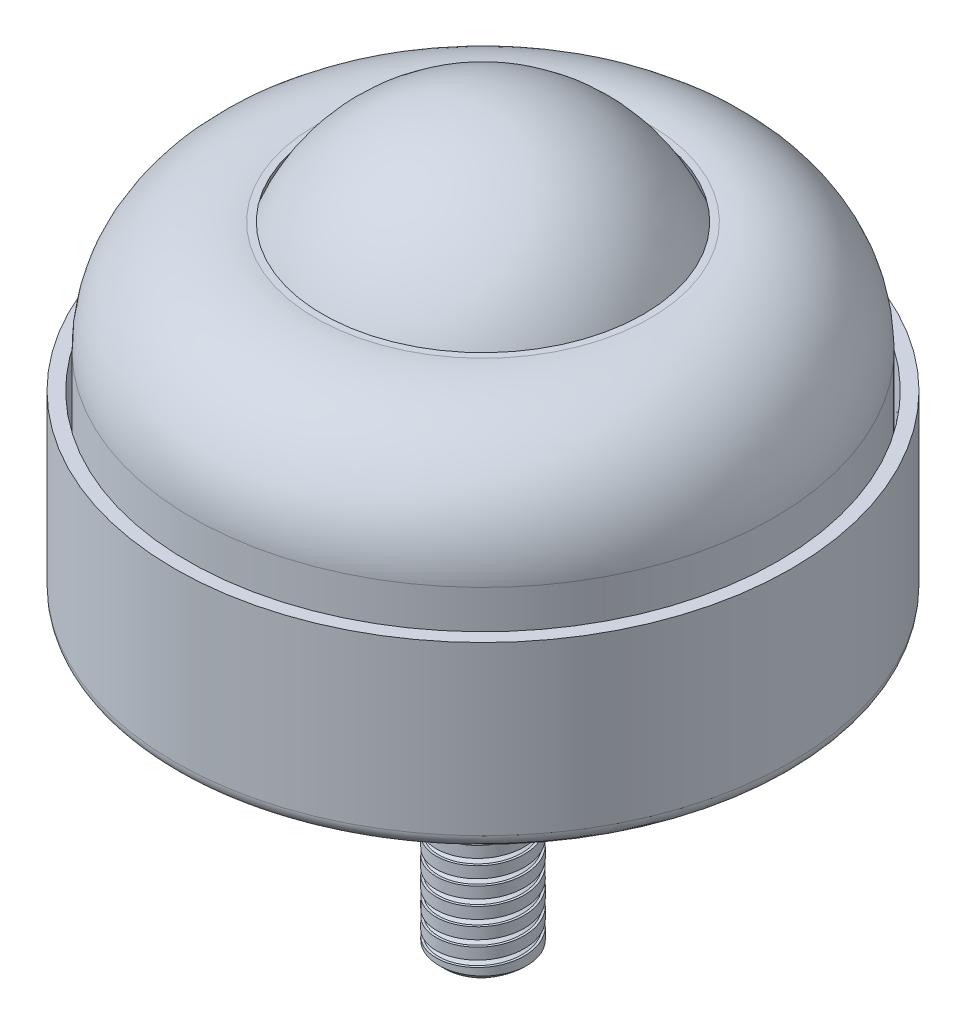
from build123d import *

# Parameters (mm, degrees)
SKETCH4_W           = 7.14375
SKETCH4_H           = 7.14375
CUT_EXTRUDE1_DEPTH  = 0.9525
SKETCH5_W           = 6.57225
SKETCH5_H           = 6.57225
CUT_EXTRUDE2_DEPTH  = 0.9525
FILLET1_R           = 1.524
FILLET2_R           = 0.1905
SKETCH7_W           = 6.35
SKETCH7_H           = 3.4925
BOSS_EXTRUDE1_DEPTH = 3.175
SKETCH8_OUTSIDE_W   = 79.734
SKETCH8_OUTSIDE_H   = 79.734
SKETCH8_OUTSIDE_R   = 4.041115254
CUT_EXTRUDE3_DEPTH  = 47.96712951
CUT_EXTRUDE3_DRAFT  = -10
FILLET3_R           = 0.127
CUT_SWEEP1_PITCH    = 1.27
CUT_SWEEP1_TO       = 17.5


with BuildPart() as part:
    # Sketch3 → Revolve1 (revolve)
    with BuildSketch(Plane.XY, mode=Mode.PRIVATE) as revolve1_sk:
        with BuildLine():
            ThreePointArc((20.955, 19.7485), (18.288003578, 25.737218359), (12.052584365, 27.761363795))
            Line((12.052584365, 27.761363795), (0, 27.761363795))
            Line((0, 27.761363795), (0, 1.5875))
            Line((0, 1.5875), (3.175, 1.5875))
            Line((3.175, 1.5875), (17.85, 1.5875))
            Line((17.85, 1.5875), (20.39, 4.1275))
            Line((20.39, 4.1275), (21.209, 4.1275))
            ThreePointArc((21.209, 4.1275), (21.92742049, 4.42507951), (22.225, 5.1435))
            Line((22.225, 5.1435), (22.225, 17.2085))
            Line((22.225, 17.2085), (21.2725, 17.2085))
            Line((21.2725, 17.2085), (20.955, 11.176))
            Line((20.955, 11.176), (20.955, 17.2085))
            Line((20.955, 17.2085), (20.955, 19.7485))
        make_face()
    revolve(revolve1_sk.sketch.rotate(Axis((0, 34.9, 0), (0, -1, 0)), 180), axis=Axis((0, 34.9, 0), (0, -1, 0)))

    # Sketch4 → Cut-Extrude1 (cut)
    with BuildSketch(Plane.XZ.offset(-1.5875)):
        Rectangle(SKETCH4_W, SKETCH4_H)
    extrude(amount=-CUT_EXTRUDE1_DEPTH, mode=Mode.SUBTRACT)

    # Sketch5 → Cut-Extrude2 (cut)
    with BuildSketch(Plane.XZ.offset(-2.54)):
        Rectangle(SKETCH5_W, SKETCH5_H)
    extrude(amount=-CUT_EXTRUDE2_DEPTH, mode=Mode.SUBTRACT)

    # Fillet1
    fillet1_edges = [part.edges().sort_by_distance(p)[0] for p in [
        (20.39, 4.1275, 0),
        (17.85, 1.5875, 0),
    ]]
    fillet(fillet1_edges, radius=FILLET1_R)

    # Fillet2
    fillet2_edges = [part.edges().sort_by_distance(p)[0] for p in [
        (-3.571875, 2.54, 0),
        (-3.571875, 2.06375, -3.571875),
        (0, 2.54, 3.571875),
        (-3.571875, 2.06375, 3.571875),
        (3.571875, 2.54, 0),
        (3.571875, 2.06375, 3.571875),
        (0, 2.54, -3.571875),
        (3.571875, 2.06375, -3.571875),
        (-3.571875, 1.5875, 0),
        (0, 1.5875, -3.571875),
        (3.571875, 1.5875, 0),
        (0, 1.5875, 3.571875),
        (-3.286125, 3.01625, -3.286125),
        (-3.286125, 3.01625, 3.286125),
        (3.286125, 3.01625, 3.286125),
        (3.286125, 3.01625, -3.286125),
    ]]
    fillet(fillet2_edges, radius=FILLET2_R)

    # Indent1: read off the stored shape, not the designer's step
    # Indent1 outline → Indent1 (revolve, cut)
    with BuildSketch(Plane.XY):
        with BuildLine():
            Line((0, 27.761363807), (0, 9.373))
            ThreePointArc((0, 9.373), (10.859731639, 15.373715672), (11.558683386, 27.761363807))
            Line((11.558683386, 27.761363807), (0, 27.761363807))
        make_face()
    revolve(axis=Axis((0, 0, 0), (0, 1, 0)), mode=Mode.SUBTRACT)


with BuildPart() as body_2:
    # Sketch6 → Revolve2 (revolve)
    with BuildSketch(Plane.XY):
        with BuildLine():
            Line((0, 34.9), (0, 9.5))
            ThreePointArc((0, 9.5), (12.7, 22.2), (0, 34.9))
        make_face()
    revolve(axis=Axis((0, 27.761363795, 0), (0, -1, 0)))


with BuildPart() as body_3:
    # Revolve3: read off the stored shape, not the designer's step
    # Revolve3 outline → Revolve3 (revolve)
    with BuildSketch(Plane.XY):
        Polygon((3.175, 1.5875), (0, 1.5875), (0, -17.5), (2.7559, -17.5), (3.175, -17.0809), align=None)
    revolve(axis=Axis((0, 0, 0), (0, 1, 0)))


with BuildPart() as body_4:
    # Sketch7 → Boss-Extrude1 (new, symmetric)
    with BuildSketch(Plane.XY):
        with Locations((0, 1.74625)):
            Rectangle(SKETCH7_W, SKETCH7_H)
    extrude(amount=BOSS_EXTRUDE1_DEPTH, both=True)


with BuildPart() as cut_extrude3_tool:
    # Sketch8 outside → Cut-Extrude3 (with draft: the straight prism first)
    with BuildSketch(Plane.XZ):
        Rectangle(SKETCH8_OUTSIDE_W, SKETCH8_OUTSIDE_H)
        Circle(SKETCH8_OUTSIDE_R, mode=Mode.SUBTRACT)
    extrude(amount=-CUT_EXTRUDE3_DEPTH)
    # Cut-Extrude3: the draft: its side faces are tilted about the plane it starts from
    cut_extrude3_sides = [cut_extrude3_tool.faces().sort_by_distance(p)[0] for p in [
        (0, 23.983564755, -39.867),
        (39.867, 23.983564755, 0),
        (0, 23.983564755, 39.867),
        (-39.867, 23.983564755, 0),
        (-4.041115254, 23.983564755, 0),
    ]]
    draft(cut_extrude3_sides, Plane.XZ, CUT_EXTRUDE3_DRAFT)


with BuildPart() as body_4_1:
    add(body_4.part)

    # Cut-Extrude3: cut by cut_extrude3_tool
    add(cut_extrude3_tool.part, mode=Mode.SUBTRACT)

    # Fillet3
    fillet3_edges = [body_4_1.edges().sort_by_distance(p)[0] for p in [
        (0, 0, 3.175),
        (3.175, 0, 0),
        (0, 0, -3.175),
        (-3.175, 0, 0),
        (-2.8575, 0, 2.8575),
        (2.8575, 0, 2.8575),
        (2.8575, 0, -2.8575),
        (-2.8575, 0, -2.8575),
    ]]
    fillet(fillet3_edges, radius=FILLET3_R)


with BuildPart() as body_3_1:
    add(body_3.part)

    # Combine1: union part, body 4
    add(part.part)
    add(body_4_1.part)


with BuildPart() as body_3_2:
    # Split1: the piece on the far side of the plane
    add(body_3_1.part)
    split(bisect_by=Plane.ZX, keep=Keep.BOTTOM)

    # Cut-Sweep1: arcs per turn and ends read off the stored shape
    # Cut-Sweep1: the profile of Sketch10 screwed along a right-hand helix through 14.779528 turns, 8 arcs to a turn; built about Z, then put on its axis
    cut_sweep1_z = Axis((0, 0, 0), (0, 0, 1))
    cut_sweep1_corners = [(3.009370383, 0, -0.784683588), (2.61262927, 0, -0.555625), (3.009370383, 0, -0.326566412), (3.209370383, 0, -0.326566412), (3.209370383, 0, -0.784683588)]
    with BuildLine(mode=Mode.PRIVATE) as cut_sweep1_profile:
        Line(cut_sweep1_corners[0], cut_sweep1_corners[1])
        Line(cut_sweep1_corners[1], cut_sweep1_corners[2])
        Line(cut_sweep1_corners[2], cut_sweep1_corners[3])
        Line(cut_sweep1_corners[3], cut_sweep1_corners[4])
        Line(cut_sweep1_corners[4], cut_sweep1_corners[0])
    cut_sweep1_cap = Face(cut_sweep1_profile.wire())
    cut_sweep1_turn_angles = [0, 22.5, 45, 67.5, 90, 112.5, 135, 157.5, 180, 202.5, 225, 247.5, 270, 292.5, 315, 337.5, 360]
    cut_sweep1_turn_weights = [1, 0.9238795325112867, 1, 0.9238795325112867, 1, 0.9238795325112867, 1, 0.9238795325112867, 1, 0.9238795325112867, 1, 0.9238795325112867, 1, 0.9238795325112867, 1, 0.9238795325112867, 1]
    cut_sweep1_turn_rails = [Edge.make_bspline([Vector(p[0], p[1], 0).rotate(cut_sweep1_z, cut_sweep1_turn_angles[k]) / cut_sweep1_turn_weights[k] + Vector(0, 0, p[2] + CUT_SWEEP1_PITCH * cut_sweep1_turn_angles[k] / 360) for k in range(17)], [0, 0, 0, 1, 1, 2, 2, 3, 3, 4, 4, 5, 5, 6, 6, 7, 7, 8, 8, 8], 2, cut_sweep1_turn_weights) for p in cut_sweep1_corners]
    cut_sweep1_turn_sides = [Face.make_surface_from_curves(cut_sweep1_turn_rails[p[0]], cut_sweep1_turn_rails[p[1]]) for p in [(0, 1), (1, 2), (2, 3), (3, 4), (4, 0)]]
    cut_sweep1_last_angles = [5040, 5062.5, 5085, 5107.5, 5130, 5152.5, 5175, 5197.5, 5220, 5242.5, 5265, 5287.5, 5310, 5315.31496063, 5320.62992126]
    cut_sweep1_last_weights = [1, 0.9238795325112867, 1, 0.9238795325112867, 1, 0.9238795325112867, 1, 0.9238795325112867, 1, 0.9238795325112867, 1, 0.9238795325112867, 1, 0.9957005451488364, 1]
    cut_sweep1_last_rails = [Edge.make_bspline([Vector(p[0], p[1], 0).rotate(cut_sweep1_z, cut_sweep1_last_angles[k]) / cut_sweep1_last_weights[k] + Vector(0, 0, p[2] + CUT_SWEEP1_PITCH * cut_sweep1_last_angles[k] / 360) for k in range(15)], [0, 0, 0, 1, 1, 2, 2, 3, 3, 4, 4, 5, 5, 6, 6, 7, 7, 7], 2, cut_sweep1_last_weights) for p in cut_sweep1_corners]
    cut_sweep1_last_sides = [Face.make_surface_from_curves(cut_sweep1_last_rails[p[0]], cut_sweep1_last_rails[p[1]]) for p in [(0, 1), (1, 2), (2, 3), (3, 4), (4, 0)]]
    cut_sweep1 = Plane(origin=(0, -17.5, 0), x_dir=(-1, 0, 0), z_dir=(0, 1, 0)) * split(Solid(Shell([*[p.moved(Location((0, 0, CUT_SWEEP1_PITCH * i))) for i in range(14) for p in cut_sweep1_turn_sides], *cut_sweep1_last_sides, cut_sweep1_cap, cut_sweep1_cap.rotate(cut_sweep1_z, 5320.62992126).moved(Location((0, 0, CUT_SWEEP1_PITCH * 5320.62992126 / 360)))])), bisect_by=Plane.XY.offset(CUT_SWEEP1_TO), keep=Keep.BOTTOM, mode=Mode.PRIVATE)
    add(cut_sweep1, mode=Mode.SUBTRACT)


with BuildPart() as body_3_3:
    add(body_3_1.part)

    # Split1
    split(bisect_by=Plane.ZX, keep=Keep.TOP)

    add(body_3_2.part)  # Boss-Extrude2 merges body 3 2
    # Boss-Extrude2: read off the stored shape, not the designer's step
    # Boss-Extrude2 outline → Boss-Extrude2 (revolve)
    with BuildSketch(Plane.XY):
        Polygon((2.61262927, 0), (2.61262927, -0.56237073), (3.175, 0), align=None)
    revolve(axis=Axis((0, 0, 0), (0, 1, 0)))


solid = Compound([body_2.part, body_3_3.part])
